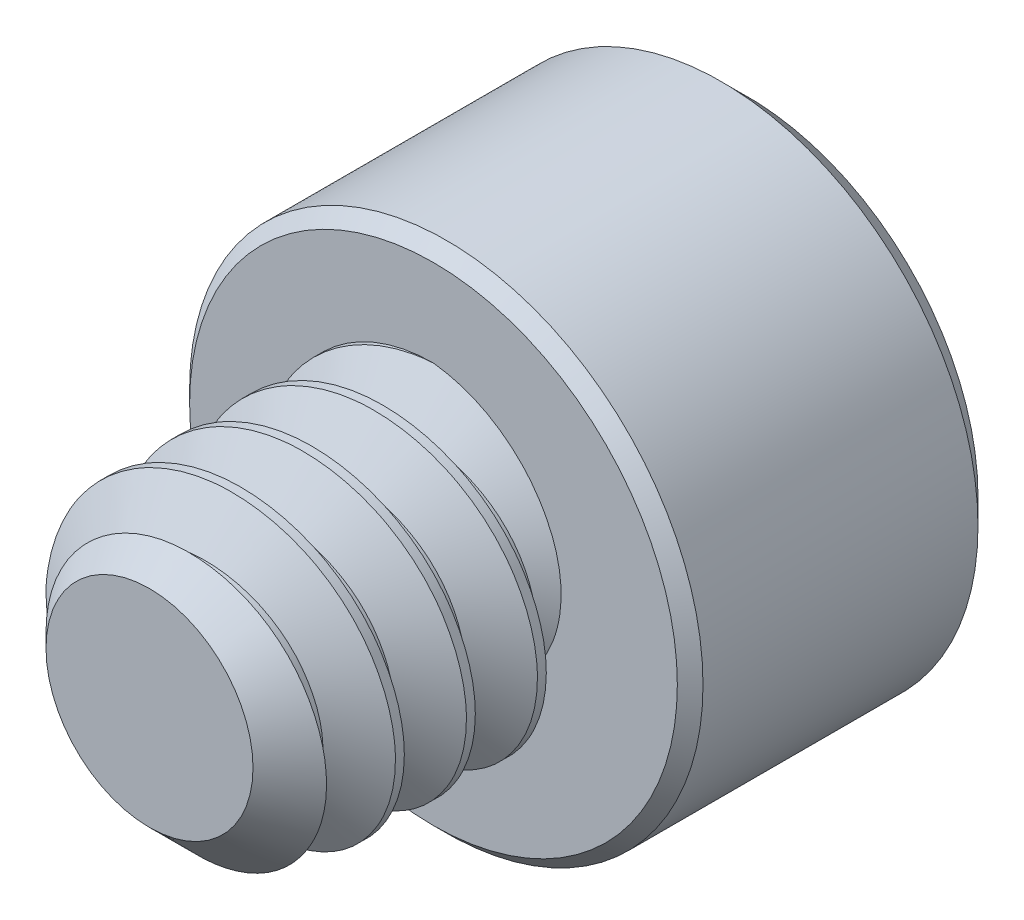
from build123d import *

# Parameters (mm, degrees)
SKETCH1_R          = 1.7526
EXTRUDE1_DEPTH     = 3.175
CHAMFER3_SIZE      = 0.5953125
CUT_SWEEP1_PITCH   = 0.79375
SKETCH6_R          = 2.8702
EXTRUDE2_DEPTH     = 3.5052
CUT_EXTRUDE1_DEPTH = 2.08359375
CHAMFER1_SIZE      = 0.28702
CHAMFER2_SIZE      = 0.14351


with BuildPart() as part:
    # Sketch1 → Extrude1 (new body)
    with BuildSketch(Plane.XY):
        Circle(SKETCH1_R)
    extrude(amount=-EXTRUDE1_DEPTH)

    # Chamfer3
    chamfer3_edges = [part.edges().sort_by_distance(p)[0] for p in [
        (-1.7526, 0, 0),
    ]]
    chamfer(chamfer3_edges, length=CHAMFER3_SIZE)

    # Cut-Sweep1: the profile of Sketch3 profile screwed along a right-hand helix of 5 turns, 6 arcs to a turn; built about Z, then put on its axis
    cut_sweep1_z = Axis((0, 0, 0), (0, 0, 1))
    cut_sweep1_corners = [(1.7529, 0, -0.694704455), (1.237044252, 0, -0.396875), (1.237044252, 0, -0.29765625), (1.7529, 0, 0.000173205)]
    with BuildLine(mode=Mode.PRIVATE) as cut_sweep1_profile:
        Line(cut_sweep1_corners[0], cut_sweep1_corners[1])
        Line(cut_sweep1_corners[1], cut_sweep1_corners[2])
        Line(cut_sweep1_corners[2], cut_sweep1_corners[3])
        Line(cut_sweep1_corners[3], cut_sweep1_corners[0])
    cut_sweep1_cap = Face(cut_sweep1_profile.wire())
    cut_sweep1_turn_angles = [0, 30, 60, 90, 120, 150, 180, 210, 240, 270, 300, 330, 360]
    cut_sweep1_turn_weights = [1, 0.8660254037844387, 1, 0.8660254037844387, 1, 0.8660254037844387, 1, 0.8660254037844387, 1, 0.8660254037844387, 1, 0.8660254037844387, 1]
    cut_sweep1_turn_rails = [Edge.make_bspline([Vector(p[0], p[1], 0).rotate(cut_sweep1_z, cut_sweep1_turn_angles[k]) / cut_sweep1_turn_weights[k] + Vector(0, 0, p[2] + CUT_SWEEP1_PITCH * cut_sweep1_turn_angles[k] / 360) for k in range(13)], [0, 0, 0, 1, 1, 2, 2, 3, 3, 4, 4, 5, 5, 6, 6, 6], 2, cut_sweep1_turn_weights) for p in cut_sweep1_corners]
    cut_sweep1_turn_sides = [Face.make_surface_from_curves(cut_sweep1_turn_rails[p[0]], cut_sweep1_turn_rails[p[1]]) for p in [(0, 1), (1, 2), (2, 3), (3, 0)]]
    cut_sweep1 = Plane(origin=(0, 0, 0), x_dir=(0, 1, 0), z_dir=(0, 0, -1)) * Solid(Shell([*[p.moved(Location((0, 0, CUT_SWEEP1_PITCH * i))) for i in range(5) for p in cut_sweep1_turn_sides], cut_sweep1_cap, cut_sweep1_cap.rotate(cut_sweep1_z, 1800).moved(Location((0, 0, CUT_SWEEP1_PITCH * 1800 / 360)))]))
    add(cut_sweep1, mode=Mode.SUBTRACT)

    # Sketch6 → Extrude2 (add)
    with BuildSketch(Plane(origin=(0, 0, -3.175), x_dir=(-1, 0, 0), z_dir=(0, 0, -1))):
        Circle(SKETCH6_R)
    extrude(amount=EXTRUDE2_DEPTH)

    # Sketch7 → Cut-Extrude1 (cut)
    with BuildSketch(Plane(origin=(0, 0, -6.6802), x_dir=(-1, 0, 0), z_dir=(0, 0, -1))):
        Polygon((0, 1.603951217), (-1.3890625, 0.801975608), (-1.3890625, -0.801975608), (0, -1.603951217), (1.3890625, -0.801975608), (1.3890625, 0.801975608), align=None)
    extrude(amount=-CUT_EXTRUDE1_DEPTH, mode=Mode.SUBTRACT)

    # Cut-Extrude2 cone 1 section (through the dimple's axis) → Cut-Extrude2 (revolve, cut)
    with BuildSketch(Plane(origin=(0, 0, -6.6802), x_dir=(0, 1, 0), z_dir=(1, 0, 0))):
        Polygon((0, 0), (1.603951217, 0), (0, 1.603951217), align=None)
    revolve(axis=Axis((0, 0, -6.6802), (0, 0, 1)), mode=Mode.SUBTRACT)

    # Chamfer1
    chamfer1_edges = [part.edges().sort_by_distance(p)[0] for p in [
        (2.8702, 0, -6.6802),
    ]]
    chamfer(chamfer1_edges, length=CHAMFER1_SIZE)

    # Chamfer2
    chamfer2_edges = [part.edges().sort_by_distance(p)[0] for p in [
        (2.8702, 0, -3.175),
    ]]
    chamfer(chamfer2_edges, length=CHAMFER2_SIZE)


solid = part.part
